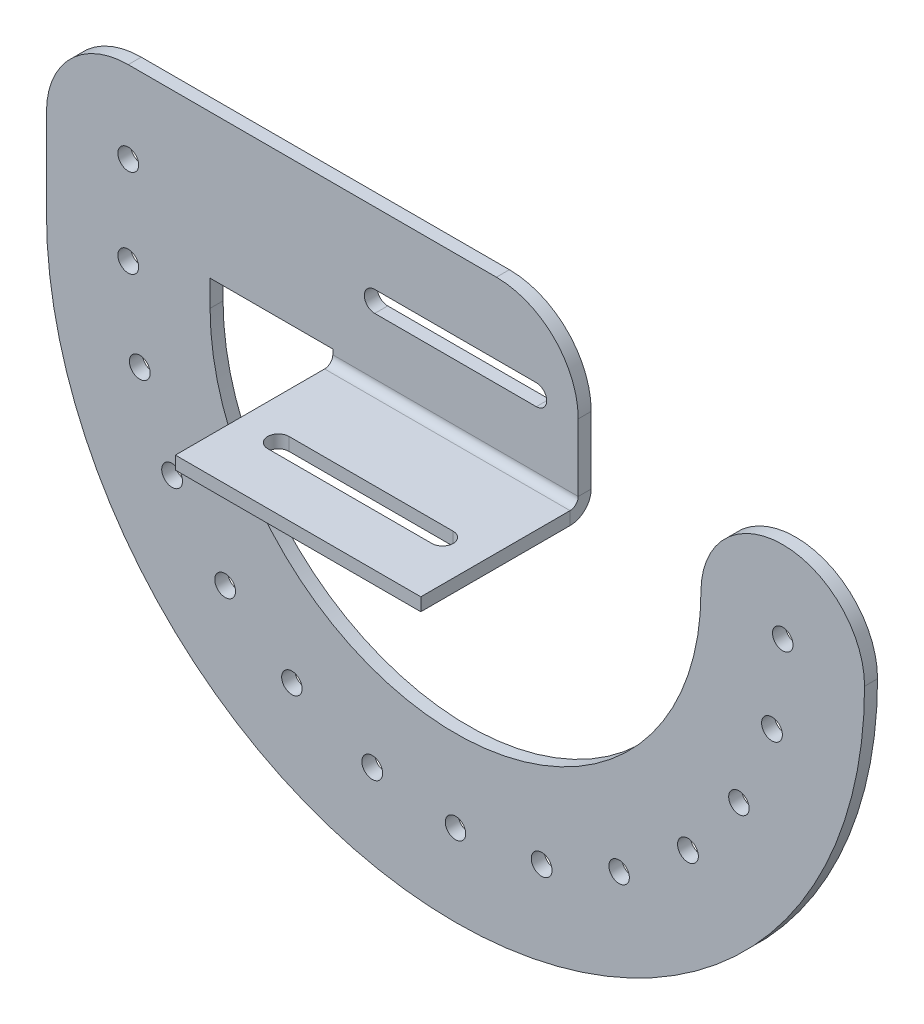
from build123d import *

# Parameters (mm, degrees)
CROQUIS1_R                = 6.35
CROQUIS1_R_2              = 6.26
CROQUIS1_R_3              = 6.25
SALIENTE_EXTRUIR1_DEPTH   = 7.9375
CROQUIS2_W                = 150
CROQUIS2_H                = 104.1375
SALIENTE_EXTRUIR2_DEPTH   = 7.9375
CONVERTIR_S_LIDO4_START   = -75
CONVERTIR_S_LIDO4_DEPTH   = 150
CONVERTIR_S_LIDO4_2_DEPTH = 150


# Read off the part's stored shape, not the designer's step: Convertir-Sólido4
with BuildPart() as part:
    # Croquis1 → Saliente-Extruir1 (new body)
    with BuildSketch(Plane.XY):
        with BuildLine():
            Line((-75, 16), (-75, 0))
            Line((-75, 0), (75, 0))
            Line((75, 0), (75, 54))
            ThreePointArc((75, 54), (60.355339059, 89.355339059), (25, 104))
            Line((25, 104), (-200, 104))
            ThreePointArc((-200, 104), (-235.355339059, 89.355339059), (-250, 54))
            Line((-250, 54), (-250, 0))
            ThreePointArc((-250, 0), (0, -250), (250, 0))
            ThreePointArc((250, 0), (200, 50), (150, 0))
            ThreePointArc((150, 0), (0, -150), (-150, 0))
            Line((-150, 0), (-150, 16))
            Line((-150, 16), (-75, 16))
        make_face()
        with BuildLine():
            ThreePointArc((-49.374105038, 47.65), (-55.724105038, 54), (-49.374105038, 60.35))
            Line((-49.374105038, 60.35), (49.374105038, 60.35))
            ThreePointArc((49.374105038, 60.35), (55.724105038, 54), (49.374105038, 47.65))
            Line((49.374105038, 47.65), (-49.374105038, 47.65))
        make_face(mode=Mode.SUBTRACT)
        with Locations((193.418858597, -50.883643138)):
            Circle(CROQUIS1_R, mode=Mode.SUBTRACT)
        with Locations((200, 0)):
            Circle(CROQUIS1_R_2, mode=Mode.SUBTRACT)
        with Locations((-100, -173.205080757)):
            Circle(CROQUIS1_R_3, mode=Mode.SUBTRACT)
        with Locations((-50.883643138, -193.418858597)):
            Circle(CROQUIS1_R, mode=Mode.SUBTRACT)
        with Locations((-140.775956893, -142.063823547)):
            Circle(CROQUIS1_R, mode=Mode.SUBTRACT)
        with Locations((-173.205080757, -100)):
            Circle(CROQUIS1_R, mode=Mode.SUBTRACT)
        with Locations((0, -200)):
            Circle(CROQUIS1_R_3, mode=Mode.SUBTRACT)
        with Locations((52.642901704, -192.947466685)):
            Circle(CROQUIS1_R, mode=Mode.SUBTRACT)
        with Locations((100, -173.205080757)):
            Circle(CROQUIS1_R_3, mode=Mode.SUBTRACT)
        with Locations((142.063823547, -140.775956893)):
            Circle(CROQUIS1_R, mode=Mode.SUBTRACT)
        with Locations((173.205080757, -100)):
            Circle(CROQUIS1_R_3, mode=Mode.SUBTRACT)
        with Locations((-192.947466685, -52.642901704)):
            Circle(CROQUIS1_R, mode=Mode.SUBTRACT)
        with Locations((-200, 0)):
            Circle(CROQUIS1_R, mode=Mode.SUBTRACT)
        with Locations((-200, 54)):
            Circle(CROQUIS1_R, mode=Mode.SUBTRACT)
    extrude(amount=SALIENTE_EXTRUIR1_DEPTH)

    # Croquis2 → Saliente-Extruir2 (add)
    with BuildSketch(Plane.XZ):
        with Locations((0, 52.06875)):
            Rectangle(CROQUIS2_W, CROQUIS2_H)
        with BuildLine():
            Line((-50.16849794, 72.5375), (50.16849794, 72.5375))
            ThreePointArc((50.16849794, 72.5375), (56.66849794, 66.0375), (50.16849794, 59.5375))
            Line((50.16849794, 59.5375), (-50.16849794, 59.5375))
            ThreePointArc((-50.16849794, 59.5375), (-56.66849794, 66.0375), (-50.16849794, 72.5375))
        make_face(mode=Mode.SUBTRACT)
    extrude(amount=-SALIENTE_EXTRUIR2_DEPTH)

    # Convertir-Sólido4 outline → Convertir-Sólido4 (cut)
    with BuildSketch(Plane.YZ.offset(CONVERTIR_S_LIDO4_START)):
        with BuildLine():
            Line((0, 12.9375), (0, 0))
            Line((0, 0), (12.9375, 0))
            ThreePointArc((12.9375, 0), (3.789306018, 3.789306018), (0, 12.9375))
        make_face()
    extrude(amount=CONVERTIR_S_LIDO4_DEPTH, mode=Mode.SUBTRACT)

    # Convertir-S_lido4 2 outline → Convertir-S_lido4 2 (add)
    with BuildSketch(Plane.YZ.offset(CONVERTIR_S_LIDO4_START)):
        with BuildLine():
            Line((7.9375, 12.9375), (7.9375, 7.9375))
            Line((7.9375, 7.9375), (12.9375, 7.9375))
            ThreePointArc((12.9375, 7.9375), (9.401966094, 9.401966094), (7.9375, 12.9375))
        make_face()
    extrude(amount=CONVERTIR_S_LIDO4_2_DEPTH)


solid = part.part
